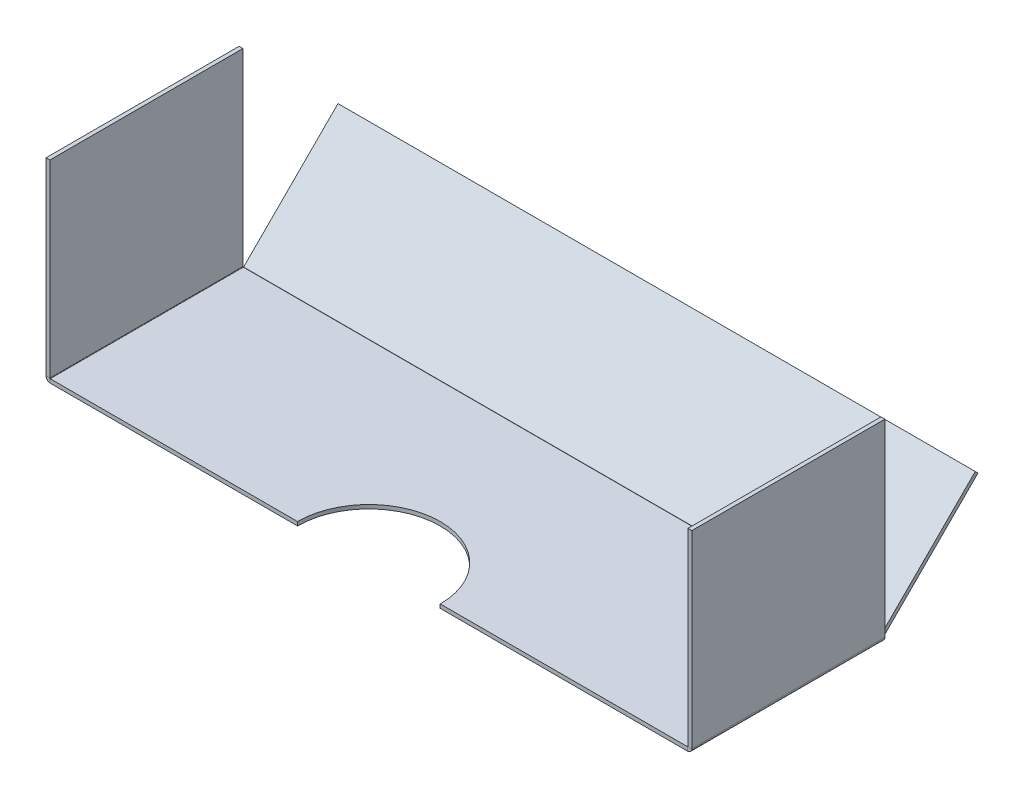
from build123d import *

# Parameters (mm, degrees)
SKETCH_1_W             = 165
SKETCH_1_H             = 50
SM_BASE_FLANGE_1_DEPTH = 1
SM_EDGE_FLANGE_1_DEPTH = 50
SKETCH_9_R             = 18.474720046
CUT_EXTRUDE_1_DEPTH    = 10
SM_EDGE_FLANGE_2_DEPTH = 165


# Sheet-metal steps are written as plain solids
with BuildPart() as part:
    # Sketch 1 → 基体-法兰1 (new body)
    with BuildSketch(Plane(origin=(0, 0, 0), x_dir=(1, 0, 0), z_dir=(0, 1, 0))):
        Rectangle(SKETCH_1_W, SKETCH_1_H)
    extrude(amount=-SM_BASE_FLANGE_1_DEPTH)

    # 边线-法兰1 section (across the edge) → 边线-法兰1 (add)
    with BuildSketch(Plane(origin=(-82.6, 0, -25), x_dir=(1, 0, 0), z_dir=(0, 0, 1))):
        with BuildLine():
            Line((-1, 0.1), (-1, 49))
            Line((-1, 49), (0, 49))
            Line((0, 49), (0, 0.1))
            ThreePointArc((0, 0.1), (0.029289322, 0.029289322), (0.1, 0))
            Line((0.1, 0), (0.1, -1))
            ThreePointArc((0.1, -1), (-0.677817459, -0.677817459), (-1, 0.1))
        make_face()
    sm_edge_flange_1 = extrude(amount=SM_EDGE_FLANGE_1_DEPTH)

    # 镜向1: 边线-法兰1 across plane
    add(sm_edge_flange_1.mirror(Plane(origin=(0, 0, 0), x_dir=(0, 0, 1), z_dir=(1, 0, 0))))

    # 草图9 → 切除-拉伸1 (cut)
    with BuildSketch(Plane(origin=(0, 0, 0), x_dir=(1, 0, 0), z_dir=(0, 1, 0))):
        with Locations((0, -25)):
            Circle(SKETCH_9_R)
    extrude(amount=-CUT_EXTRUDE_1_DEPTH, mode=Mode.SUBTRACT)

    # 边线-法兰2 section (across the edge) → 边线-法兰2 (add)
    with BuildSketch(Plane(origin=(82.5, 0, -25.041421356), x_dir=(0, 0.7071067811865512, 0.7071067811865438), z_dir=(-1, 0, 0))):
        with BuildLine():
            Line((-1, 0.041421356), (-1, 34.585786438))
            Line((-1, 34.585786438), (0, 34.585786438))
            Line((0, 34.585786438), (0, 0.041421356))
            ThreePointArc((0, 0.041421356), (0.007612047, 0.003153013), (0.029289322, -0.029289322))
            Line((0.029289322, -0.029289322), (-0.677817459, -0.736396103))
            ThreePointArc((-0.677817459, -0.736396103), (-0.916267486, -0.379530419), (-1, 0.041421356))
        make_face()
    extrude(amount=SM_EDGE_FLANGE_2_DEPTH)


solid = part.part
